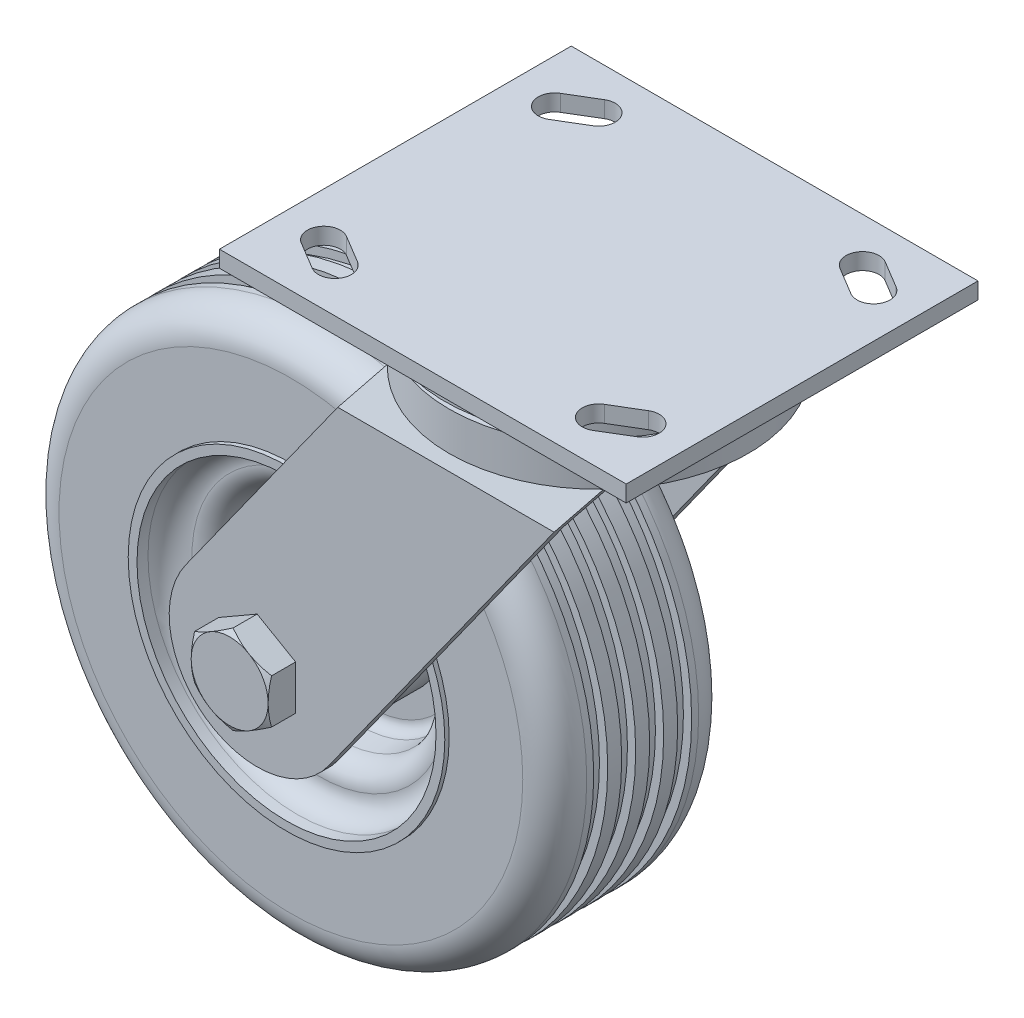
from build123d import *

# Parameters (mm, degrees)
SKETCH1_W               = 117.475
SKETCH1_H               = 4.7625
BOSS_EXTRUDE1_DEPTH     = 50.8
F_1_2_HOLES_DEPTH       = 78.803697293
SKETCH7_W               = 170.933784369
SKETCH7_H               = 70.3072
BOSS_EXTRUDE2_DEPTH     = 164.9349
CUT_EXTRUDE1_START      = -70.3072
CUT_EXTRUDE1_DEPTH      = 70.3072
CUT_EXTRUDE3_DEPTH      = 208.174206511
CUT_EXTRUDE3_DEPTH_BACK = 208.174206511
SKETCH9_OUTSIDE_W       = 162.248
SKETCH9_OUTSIDE_H       = 251.148
BOSS_EXTRUDE3_DEPTH     = 7.9375
SKETCH11_OUTSIDE_W      = 1143.154
SKETCH11_OUTSIDE_H      = 1135.216
SKETCH11_OUTSIDE_R      = 11.1125
CUT_EXTRUDE4_DEPTH      = 255.208337191
CUT_EXTRUDE4_DRAFT      = -60
SKETCH12_R              = 10.795
BOSS_EXTRUDE4_DEPTH     = 64.77


# Read off the part's stored shape, not the designer's step: Cut-Extrude1
with BuildPart() as part:
    # Sketch1 → Boss-Extrude1 (new, symmetric)
    with BuildSketch(Plane.XY):
        with Locations((0, -2.38125)):
            Rectangle(SKETCH1_W, SKETCH1_H)
    extrude(amount=BOSS_EXTRUDE1_DEPTH, both=True)

    # Sketch2 → 1-2 holes (cut, through all)
    with BuildSketch(Plane(origin=(0, 0, 0), x_dir=(1, 0, 0), z_dir=(0, 1, 0))):
        with BuildLine():
            Line((-35.649713965, 34.016189941), (-43.587213965, 29.253689941))
            ThreePointArc((-43.587213965, 29.253689941), (-50.121310059, 30.887213965), (-48.487786035, 37.421310059))
            Line((-48.487786035, 37.421310059), (-40.550286035, 42.183810059))
            ThreePointArc((-40.550286035, 42.183810059), (-34.016189941, 40.550286035), (-35.649713965, 34.016189941))
        make_face()
        with BuildLine():
            Line((-35.649713965, -34.016189941), (-43.587213965, -29.253689941))
            ThreePointArc((-43.587213965, -29.253689941), (-50.121310059, -30.887213965), (-48.487786035, -37.421310059))
            Line((-48.487786035, -37.421310059), (-40.550286035, -42.183810059))
            ThreePointArc((-40.550286035, -42.183810059), (-34.016189941, -40.550286035), (-35.649713965, -34.016189941))
        make_face()
        with BuildLine():
            Line((35.649713965, 34.016189941), (43.587213965, 29.253689941))
            ThreePointArc((43.587213965, 29.253689941), (50.121310059, 30.887213965), (48.487786035, 37.421310059))
            Line((48.487786035, 37.421310059), (40.550286035, 42.183810059))
            ThreePointArc((40.550286035, 42.183810059), (34.016189941, 40.550286035), (35.649713965, 34.016189941))
        make_face()
        with BuildLine():
            Line((35.649713965, -34.016189941), (43.587213965, -29.253689941))
            ThreePointArc((43.587213965, -29.253689941), (50.121310059, -30.887213965), (48.487786035, -37.421310059))
            Line((48.487786035, -37.421310059), (40.550286035, -42.183810059))
            ThreePointArc((40.550286035, -42.183810059), (34.016189941, -40.550286035), (35.649713965, -34.016189941))
        make_face()
    extrude(amount=-F_1_2_HOLES_DEPTH, mode=Mode.SUBTRACT)


with BuildPart() as body_2:
    # Sketch4 → Revolve1 (revolve)
    with BuildSketch(Plane.XY, mode=Mode.PRIVATE) as revolve1_sk:
        Polygon((0, -25.5651), (43.18, -25.5651), (43.18, -14.4526), (40.64, -14.4526), (40.64, -11.9126), (44.45, -11.9126), (44.45, -4.7625), (0, -4.7625), align=None)
    revolve(revolve1_sk.sketch.rotate(Axis((0, -4.7625, 0), (0, -1, 0)), 180), axis=Axis((0, -4.7625, 0), (0, -1, 0)))


with BuildPart() as body_3:
    # Sketch6 → Revolve2 (revolve)
    with BuildSketch(Plane(origin=(-63.5, 0, 0), x_dir=(0, 0, -1), z_dir=(1, 0, 0)), mode=Mode.PRIVATE) as revolve2_sk:
        with BuildLine():
            Line((-25.4, -68.58), (-25.4, -47.336363636))
            ThreePointArc((-25.4, -47.336363636), (-22.694731724, -40.805268276), (-16.163636364, -38.1))
            Line((-16.163636364, -38.1), (-14.143181818, -38.1))
            Line((-14.143181818, -38.1), (-14.143181818, -40.48125))
            Line((-14.143181818, -40.48125), (-10.102272727, -40.48125))
            Line((-10.102272727, -40.48125), (-10.102272727, -38.1))
            Line((-10.102272727, -38.1), (-6.061363636, -38.1))
            Line((-6.061363636, -38.1), (-6.061363636, -40.48125))
            Line((-6.061363636, -40.48125), (-2.020454545, -40.48125))
            Line((-2.020454545, -40.48125), (-2.020454545, -38.1))
            Line((-2.020454545, -38.1), (2.020454545, -38.1))
            Line((2.020454545, -38.1), (2.020454545, -40.48125))
            Line((2.020454545, -40.48125), (6.061363636, -40.48125))
            Line((6.061363636, -40.48125), (6.061363636, -38.1))
            Line((6.061363636, -38.1), (10.102272727, -38.1))
            Line((10.102272727, -38.1), (10.102272727, -40.48125))
            Line((10.102272727, -40.48125), (14.143181818, -40.48125))
            Line((14.143181818, -40.48125), (14.143181818, -38.1))
            Line((14.143181818, -38.1), (16.163636364, -38.1))
            ThreePointArc((16.163636364, -38.1), (22.694731724, -40.805268276), (25.4, -47.336363636))
            Line((25.4, -47.336363636), (25.4, -68.58))
            Line((25.4, -68.58), (26.67, -68.58))
            Line((26.67, -68.58), (26.67, -71.12))
            Line((26.67, -71.12), (23.495, -71.12))
            ThreePointArc((23.495, -71.12), (19.004871939, -72.979871939), (17.145, -77.47))
            ThreePointArc((17.145, -77.47), (15.476711089, -81.759997818), (11.348438966, -83.795836333))
            Line((11.348438966, -83.795836333), (5.438280517, -84.312908197))
            ThreePointArc((5.438280517, -84.312908197), (3.374144456, -85.330827454), (2.54, -87.475826363))
            Line((2.54, -87.475826363), (2.54, -93.6625))
            Line((2.54, -93.6625), (26.67, -93.6625))
            Line((26.67, -93.6625), (29.845, -93.6625))
            Line((29.845, -93.6625), (29.845, -114.3))
            Line((29.845, -114.3), (-29.845, -114.3))
            Line((-29.845, -114.3), (-29.845, -93.6625))
            Line((-29.845, -93.6625), (-26.67, -93.6625))
            Line((-26.67, -93.6625), (-2.54, -93.6625))
            Line((-2.54, -93.6625), (-2.54, -87.475826363))
            ThreePointArc((-2.54, -87.475826363), (-3.374144456, -85.330827454), (-5.438280517, -84.312908197))
            Line((-5.438280517, -84.312908197), (-11.348438966, -83.795836333))
            ThreePointArc((-11.348438966, -83.795836333), (-15.476711089, -81.759997818), (-17.145, -77.47))
            ThreePointArc((-17.145, -77.47), (-19.004871939, -72.979871939), (-23.495, -71.12))
            Line((-23.495, -71.12), (-26.67, -71.12))
            Line((-26.67, -71.12), (-26.67, -68.58))
            Line((-26.67, -68.58), (-25.4, -68.58))
        make_face()
    revolve(revolve2_sk.sketch.rotate(Axis((-63.5, -114.3, 111.145303652), (0, 0, -1)), 90), axis=Axis((-63.5, -114.3, 111.145303652), (0, 0, -1)))


with BuildPart() as body_4:
    # Sketch7 → Boss-Extrude2 (new body)
    with BuildSketch(Plane.XZ.offset(25.5651)):
        with Locations((-54.233107816, 0)):
            Rectangle(SKETCH7_W, SKETCH7_H)
    extrude(amount=BOSS_EXTRUDE2_DEPTH)

    # Cut-Extrude1 outline → Cut-Extrude1 (cut)
    with BuildSketch(Plane.XY.offset(35.1536).offset(CUT_EXTRUDE1_START)):
        with BuildLine():
            Line((31.233784369, -25.5651), (-42.844161681, -129.081621811))
            ThreePointArc((-42.844161681, -129.081621811), (-78.281621811, -134.955838319), (-84.155838319, -99.518378189))
            Line((-84.155838319, -99.518378189), (-31.233784369, -25.5651))
            Line((-31.233784369, -25.5651), (-139.7, -25.5651))
            Line((-139.7, -25.5651), (-139.7, -190.5))
            Line((-139.7, -190.5), (31.233784369, -190.5))
            Line((31.233784369, -190.5), (31.233784369, -25.5651))
        make_face()
    extrude(amount=CUT_EXTRUDE1_DEPTH, mode=Mode.SUBTRACT)

    # Sketch9 outside → Cut-Extrude3 (cut, two sides: drawn at the far end of the back side and taken through both)
    with BuildSketch(Plane(origin=(0, -144.306693689, 0), x_dir=(0, 0, -1), z_dir=(-1, 0, 0)).offset(-CUT_EXTRUDE3_DEPTH_BACK)):
        with Locations((0, -49.057)):
            Rectangle(SKETCH9_OUTSIDE_W, SKETCH9_OUTSIDE_H)
        Polygon((35.1536, 46.193306311), (35.1536, -106.206693689), (29.815484467, -118.741593689), (27.046884467, -118.741593689), (32.385, -106.206693689), (32.385, 46.193306311), align=None, mode=Mode.SUBTRACT)
        Polygon((-27.046884467, -118.741593689), (-29.815484467, -118.741593689), (-35.1536, -106.206693689), (-35.1536, 46.193306311), (-32.385, 46.193306311), (-32.385, -106.206693689), align=None, mode=Mode.SUBTRACT)
    extrude(amount=CUT_EXTRUDE3_DEPTH + CUT_EXTRUDE3_DEPTH_BACK, mode=Mode.SUBTRACT)


with BuildPart() as cut_extrude3_piece_1:
    # of the separate pieces the step leaves, piece 1, a body of its own (cut_extrude3_pieces)
    add(body_4.part.solids().sort_by_distance((22.263625503, -38.1, 35.1536))[0])



with BuildPart() as cut_extrude3_piece_2:
    # of the separate pieces the step leaves, piece 2, a body of its own (cut_extrude3_pieces)
    add(body_4.part.solids().sort_by_distance((31.233784369, -25.5651, -29.815484467))[0])


with BuildPart() as body_6:
    # Sketch10 → Boss-Extrude3 (new body)
    with BuildSketch(Plane.XY.offset(35.1536)):
        Polygon((-63.5, -101.468390267), (-74.6125, -107.884195134), (-74.6125, -120.715804866), (-63.5, -127.131609733), (-52.3875, -120.715804866), (-52.3875, -107.884195134), align=None)
    extrude(amount=BOSS_EXTRUDE3_DEPTH)


with BuildPart() as cut_extrude4_tool:
    # Sketch11 outside → Cut-Extrude4 (with draft: the straight prism first)
    with BuildSketch(Plane.XY.offset(43.0911)):
        with Locations((-40.481, -95.25)):
            Rectangle(SKETCH11_OUTSIDE_W, SKETCH11_OUTSIDE_H)
        with Locations((-63.5, -114.3)):
            Circle(SKETCH11_OUTSIDE_R, mode=Mode.SUBTRACT)
    extrude(amount=-CUT_EXTRUDE4_DEPTH)
    # Cut-Extrude4: the draft: its side faces are tilted about the plane it starts from
    cut_extrude4_sides = [cut_extrude4_tool.faces().sort_by_distance(p)[0] for p in [
        (-40.481, -662.858, -84.513068595),
        (531.096, -95.25, -84.513068595),
        (-40.481, 472.358, -84.513068595),
        (-612.058, -95.25, -84.513068595),
        (-74.6125, -114.3, -84.513068595),
    ]]
    draft(cut_extrude4_sides, Plane.XY.offset(43.0911), CUT_EXTRUDE4_DRAFT)


with BuildPart() as body_6_1:
    add(body_6.part)

    # Cut-Extrude4: cut by cut_extrude4_tool
    add(cut_extrude4_tool.part, mode=Mode.SUBTRACT)


with BuildPart() as body_7:
    # Mirror1: mirrored copy
    add(body_6_1.part.mirror(Plane.XY))


with BuildPart() as cut_extrude3_piece_1_1:
    add(cut_extrude3_piece_1.part)

    add(cut_extrude3_piece_2.part)  # Boss-Extrude4 merges Cut-Extrude3 piece 2
    # Sketch12 → Boss-Extrude4 (add)
    with BuildSketch(Plane.XY.offset(-32.385)):
        with Locations(Location((-63.5, -114.3, 0), (0, 0, 180))):
            Circle(SKETCH12_R)
    extrude(amount=BOSS_EXTRUDE4_DEPTH)

    # Combine1: union body 7, body 6, body 2, part
    add(body_7.part)
    add(body_6_1.part)
    add(body_2.part)
    add(part.part)


solid = Compound([body_3.part, cut_extrude3_piece_1_1.part])
